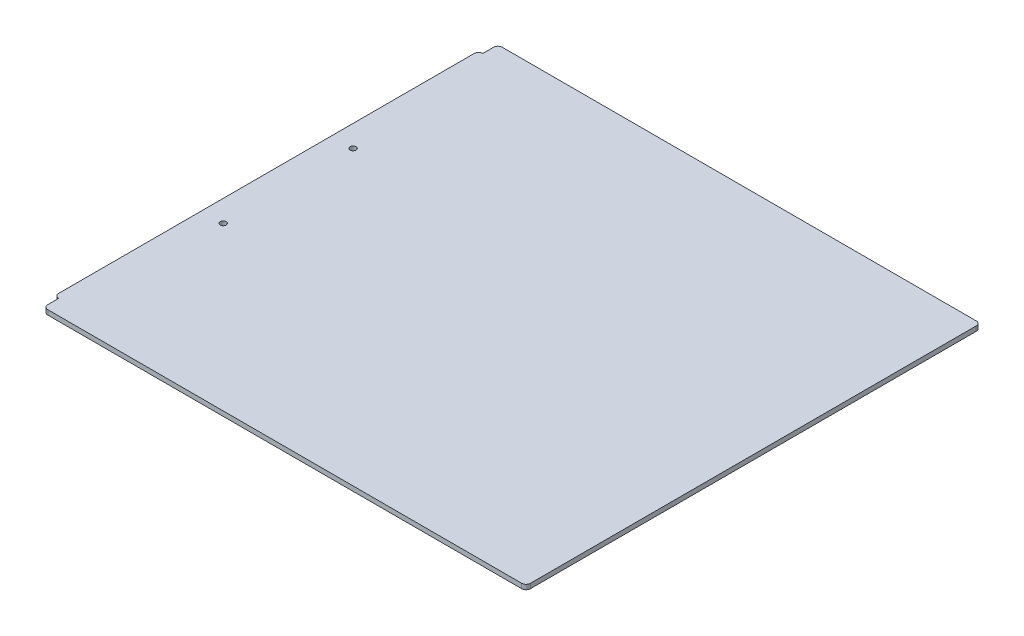
from build123d import *

# Parameters (mm, degrees)
SKETCH1_W           = 304.8
SKETCH1_H           = 304.8
BOSS_EXTRUDE1_DEPTH = 2.778125
SKETCH2_W           = 304.8
SKETCH2_H           = 19.05
CUT_EXTRUDE1_DEPTH  = 432.061246204
SKETCH4_R           = 1.7526
CUT_EXTRUDE3_DEPTH  = 418.808353768
SKETCH5_W           = 19.05
SKETCH5_H           = 266.7
CUT_EXTRUDE4_DEPTH  = 418.808353768
SKETCH6_W           = 2.54
SKETCH6_H           = 8.89
CUT_EXTRUDE5_DEPTH  = 405.121074653
FILLET1_R           = 2.54


with BuildPart() as part:
    # Sketch1 → Boss-Extrude1 (new body)
    with BuildSketch(Plane(origin=(0, 0, 0), x_dir=(1, 0, 0), z_dir=(0, 1, 0))):
        with Locations((152.4, 152.4)):
            Rectangle(SKETCH1_W, SKETCH1_H)
    extrude(amount=BOSS_EXTRUDE1_DEPTH)

    # Sketch2 → Cut-Extrude1 (cut, through all)
    with BuildSketch(Plane(origin=(0, 2.778125, 0), x_dir=(1, 0, 0), z_dir=(0, 1, 0))):
        with Locations((152.4, 9.525)):
            Rectangle(SKETCH2_W, SKETCH2_H)
        with Locations((152.4, 295.275)):
            Rectangle(SKETCH2_W, SKETCH2_H)
    extrude(amount=-CUT_EXTRUDE1_DEPTH, mode=Mode.SUBTRACT)

    # Sketch4 → Cut-Extrude3 (cut, through all)
    with BuildSketch(Plane(origin=(0, 2.778125, 0), x_dir=(1, 0, 0), z_dir=(0, 1, 0))):
        with Locations(Location((12.7, 190.5762, 0), (0, 0, 270))):
            Circle(SKETCH4_R)
        with Locations(Location((12.7, 114.3762, 0), (0, 0, 270))):
            Circle(SKETCH4_R)
    extrude(amount=-CUT_EXTRUDE3_DEPTH, mode=Mode.SUBTRACT)

    # Sketch5 → Cut-Extrude4 (cut, through all)
    with BuildSketch(Plane(origin=(0, 2.778125, 0), x_dir=(1, 0, 0), z_dir=(0, 1, 0))):
        with Locations((295.275, 152.4)):
            Rectangle(SKETCH5_W, SKETCH5_H)
    extrude(amount=-CUT_EXTRUDE4_DEPTH, mode=Mode.SUBTRACT)

    # Sketch6 → Cut-Extrude5 (cut, through all)
    with BuildSketch(Plane(origin=(0, 2.778125, 0), x_dir=(1, 0, 0), z_dir=(0, 1, 0))):
        with Locations((1.27, 281.305)):
            Rectangle(SKETCH6_W, SKETCH6_H)
        with Locations((1.27, 23.495)):
            Rectangle(SKETCH6_W, SKETCH6_H)
    extrude(amount=-CUT_EXTRUDE5_DEPTH, mode=Mode.SUBTRACT)

    # Fillet1
    fillet1_edges = [part.edges().sort_by_distance(p)[0] for p in [
        (285.75, 1.3890625, -19.05),
        (285.75, 1.3890625, -285.75),
        (0, 1.3890625, -276.86),
        (2.54, 1.3890625, -285.75),
        (2.54, 1.3890625, -19.05),
        (0, 1.3890625, -27.94),
    ]]
    fillet(fillet1_edges, radius=FILLET1_R - 0.0001)  # a hair under: the kernel refuses the full size


solid = part.part
